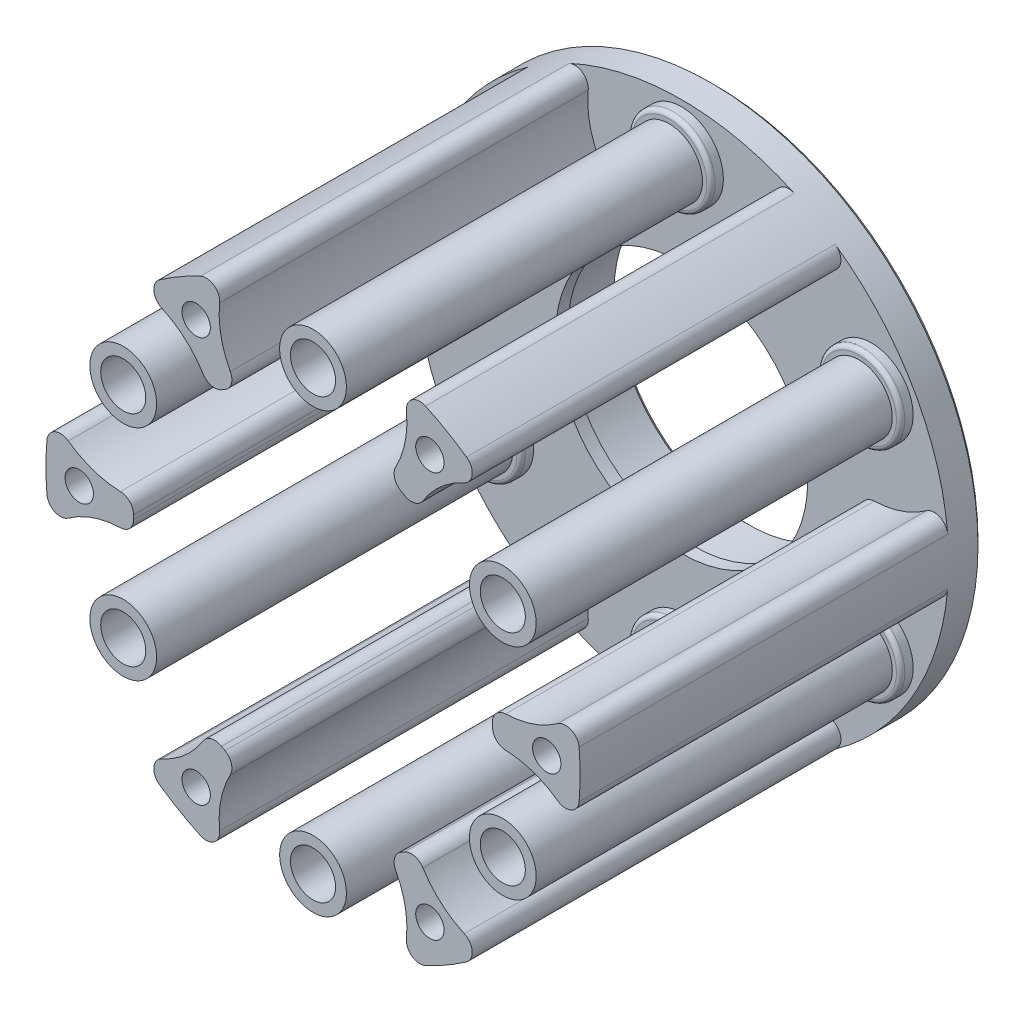
from build123d import *

# Parameters (mm, degrees)
SKETCH1_R               = 32
SKETCH1_R_2             = 2.7
SKETCH1_R_3             = 2.6999999999999793
SKETCH1_R_4             = 2.69999999999999
SKETCH1_R_5             = 2.700000000000006
SKETCH1_R_6             = 2.699999999999994
SKETCH1_R_7             = 2.700000000000001
BOSS_EXTRUDE1_DEPTH     = 4
SKETCH2_R               = 4.000000000000011
SKETCH2_R_2             = 2.7
BOSS_EXTRUDE2_DEPTH     = 44.16053674
SKETCH3_R               = 5.000000000000011
SKETCH3_R_2             = 4.000000000000011
BOSS_EXTRUDE3_DEPTH     = 1.5
BOSS_EXTRUDE4_DEPTH     = 44.16053674
FILLET2_R               = 0.5
FILLET5_R               = 1.61977879287575
CIRPATTERN1_START       = 4
CIRPATTERN1_DEPTH       = 44.16053674
CHAMFER1_SIZE           = 0.5
SKETCH9_R               = 8
CUT_EXTRUDE4_DEPTH      = 64.23094991218304
BOSS_EXTRUDE7_START     = -6.5
SKETCH10_R              = 8
SKETCH10_R_2            = 6.500000000000002
BOSS_EXTRUDE7_DEPTH     = 6.5
CUT_EXTRUDE5_DEPTH      = 64.23094991218304
CUT_EXTRUDE5_DEPTH_BACK = 64.23094991218304
SKETCH14_R              = 16.1
SKETCH15_R              = 16.1
SKETCH15_R_2            = 15.1
BOSS_EXTRUDE8_DEPTH     = 1.5
SKETCH16_R              = 18.099999999999998
SKETCH16_R_2            = 16.1
BOSS_EXTRUDE9_DEPTH     = 4.5
CHAMFER3_SIZE2          = 4.5
CHAMFER3_SIZE           = 2
SKETCH5_R               = 1.6999999999999995
CUT_EXTRUDE1_DEPTH      = 70.43437291820881
CUT_EXTRUDE3_START      = -5
SKETCH7_R               = 4.45
CUT_EXTRUDE3_DEPTH      = 72.08658957395971
CUT_EXTRUDE2_START      = -3
SKETCH6_R               = 2.949999999999979
CUT_EXTRUDE2_DEPTH      = 70.08658957395971
CIRPATTERN2_COUNT       = 6
CHAMFER4_SIZE           = 0.5


# Read off the part's stored shape, not the designer's step: CirPattern1
with BuildPart() as part:
    # Sketch1 → Boss-Extrude1 (new body)
    with BuildSketch(Plane.XY):
        Circle(SKETCH1_R)
        with Locations((-6.5e-16, 26.25)):
            Circle(SKETCH1_R_2, mode=Mode.SUBTRACT)
        with Locations((22.73316684934151, 13.125000000000004)):
            Circle(SKETCH1_R_3, mode=Mode.SUBTRACT)
        with Locations((22.733166849341515, -13.124999999999995)):
            Circle(SKETCH1_R_4, mode=Mode.SUBTRACT)
        with Locations((3.87e-15, -26.25)):
            Circle(SKETCH1_R_5, mode=Mode.SUBTRACT)
        with Locations((-22.733166849341508, -13.125000000000012)):
            Circle(SKETCH1_R_6, mode=Mode.SUBTRACT)
        with Locations((-22.733166849341515, 13.125000000000002)):
            Circle(SKETCH1_R_7, mode=Mode.SUBTRACT)
    extrude(amount=BOSS_EXTRUDE1_DEPTH)

    # Sketch2 → Boss-Extrude2 (add)
    with BuildSketch(Plane.XY.offset(4)):
        with Locations((-6.5e-16, 26.25)):
            Circle(SKETCH2_R)
        with Locations((-6.5e-16, 26.25)):
            Circle(SKETCH2_R_2, mode=Mode.SUBTRACT)
    extrude(amount=BOSS_EXTRUDE2_DEPTH)

    # Sketch3 → Boss-Extrude3 (add)
    with BuildSketch(Plane.XY.offset(4)):
        with Locations((-6.5e-16, 26.25)):
            Circle(SKETCH3_R)
        with Locations((-6.5e-16, 26.25)):
            Circle(SKETCH3_R_2, mode=Mode.SUBTRACT)
    extrude(amount=BOSS_EXTRUDE3_DEPTH)

    # Sketch4 → Boss-Extrude4 (add)
    with BuildSketch(Plane.XY.offset(4)):
        with BuildLine():
            ThreePointArc((-9.014254270063137, 19.51904761904762), (-11.13928536235289, 24.675572606923186), (-10.526593038477948, 30.219047619047622))
            ThreePointArc((-10.52659303847795, 30.21904761904762), (-16.000000000000043, 27.71281292110201), (-20.907166397027993, 24.22582079614607))
            ThreePointArc((-20.907166397027996, 24.225820796146074), (-15.800030049346507, 21.984690407263294), (-12.39686396074188, 17.566097003570803))
            ThreePointArc((-12.396863960741879, 17.566097003570803), (-10.750000000000021, 18.61954618136542), (-9.014254270063137, 19.51904761904762))
        make_face()
    extrude(amount=BOSS_EXTRUDE4_DEPTH)

    # Fillet2
    fillet2_edges = [part.edges().sort_by_distance(p)[0] for p in [
        (-5.0000000000000115, 26.25, 5.5),
    ]]
    fillet(fillet2_edges, radius=FILLET2_R)

    # Fillet5
    fillet5_edges = [part.edges().sort_by_distance(p)[0] for p in [
        (-10.52659303847795, 30.219047619047622, 26.08026837),
        (-20.907166397027993, 24.22582079614607, 26.08026837),
        (-12.396863960741879, 17.566097003570803, 26.08026837),
        (-9.014254270063137, 19.51904761904762, 26.08026837),
    ]]
    fillet(fillet5_edges, radius=FILLET5_R)

    # CirPattern1 outline → CirPattern1 (add)
    with BuildSketch(Plane.XY.offset(CIRPATTERN1_START)):
        with BuildLine():
            ThreePointArc((-21.498630106, 0.242700588), (-21.94958884, 1.382495109), (-23.069832464, 1.880038628))
            ThreePointArc((-23.069832464, 1.880038628), (-26.350618082, 2.472462904), (-29.31372479, 4.000376326))
            ThreePointArc((-29.31372479, 4.000376326), (-30.934551738, 4.15979527), (-31.874628466, 2.829851609))
            ThreePointArc((-31.874628466, 2.829851609), (-32, 0), (-31.874628466, -2.829851609))
            ThreePointArc((-31.874628466, -2.829851609), (-30.934551738, -4.15979527), (-29.31372479, -4.000376326))
            ThreePointArc((-29.31372479, -4.000376326), (-26.350618082, -2.472462904), (-23.069832464, -1.880038628))
            ThreePointArc((-23.069832464, -1.880038628), (-21.94958884, -1.382495109), (-21.498630106, -0.242700588))
            ThreePointArc((-21.498630106, -0.242700588), (-21.5, 0), (-21.498630106, 0.242700588))
        make_face()
        with BuildLine():
            ThreePointArc((18.388037615, 26.189312184), (16, 27.712812921), (13.486590851, 29.019163793))
            ThreePointArc((13.486590851, 29.019163793), (11.86478749, 28.870005296), (11.192434872, 27.386618511))
            ThreePointArc((11.192434872, 27.386618511), (11.034093356, 24.056536116), (9.90675502, 20.919080289))
            ThreePointArc((9.90675502, 20.919080289), (9.777518535, 19.700149093), (10.539130178, 18.739710112))
            ThreePointArc((10.539130178, 18.739710112), (10.75, 18.619546181), (10.959499928, 18.497009524))
            ThreePointArc((10.959499928, 18.497009524), (12.172070305, 18.317653984), (13.163077444, 19.039041661))
            ThreePointArc((13.163077444, 19.039041661), (15.316524725, 21.584073212), (18.121289918, 23.386242185))
            ThreePointArc((18.121289918, 23.386242185), (19.069764248, 24.710210026), (18.388037615, 26.189312184))
        make_face()
        with BuildLine():
            ThreePointArc((-18.121289918, -23.386242185), (-19.069764248, -24.710210026), (-18.388037615, -26.189312184))
            ThreePointArc((-18.388037615, -26.189312184), (-16, -27.712812921), (-13.486590851, -29.019163793))
            ThreePointArc((-13.486590851, -29.019163793), (-11.86478749, -28.870005296), (-11.192434872, -27.386618511))
            ThreePointArc((-11.192434872, -27.386618511), (-11.034093356, -24.056536116), (-9.90675502, -20.919080289))
            ThreePointArc((-9.90675502, -20.919080289), (-9.777518535, -19.700149093), (-10.539130178, -18.739710112))
            ThreePointArc((-10.539130178, -18.739710112), (-10.75, -18.619546181), (-10.959499928, -18.497009524))
            ThreePointArc((-10.959499928, -18.497009524), (-12.172070305, -18.317653984), (-13.163077444, -19.039041661))
            ThreePointArc((-13.163077444, -19.039041661), (-15.316524725, -21.584073212), (-18.121289918, -23.386242185))
        make_face()
        with BuildLine():
            ThreePointArc((31.874628466, -2.829851609), (32, 0), (31.874628466, 2.829851609))
            ThreePointArc((31.874628466, 2.829851609), (30.934551738, 4.15979527), (29.31372479, 4.000376326))
            ThreePointArc((29.31372479, 4.000376326), (26.350618082, 2.472462904), (23.069832464, 1.880038628))
            ThreePointArc((23.069832464, 1.880038628), (21.94958884, 1.382495109), (21.498630106, 0.242700588))
            ThreePointArc((21.498630106, 0.242700588), (21.5, 0), (21.498630106, -0.242700588))
            ThreePointArc((21.498630106, -0.242700588), (21.94958884, -1.382495109), (23.069832464, -1.880038628))
            ThreePointArc((23.069832464, -1.880038628), (26.350618082, -2.472462904), (29.31372479, -4.000376326))
            ThreePointArc((29.31372479, -4.000376326), (30.934551738, -4.15979527), (31.874628466, -2.829851609))
        make_face()
        with BuildLine():
            ThreePointArc((11.192434872, -27.386618511), (11.86478749, -28.870005296), (13.486590851, -29.019163793))
            ThreePointArc((13.486590851, -29.019163793), (16, -27.712812921), (18.388037615, -26.189312184))
            ThreePointArc((18.388037615, -26.189312184), (19.069764248, -24.710210026), (18.121289918, -23.386242185))
            ThreePointArc((18.121289918, -23.386242185), (15.316524725, -21.584073212), (13.163077444, -19.039041661))
            ThreePointArc((13.163077444, -19.039041661), (12.172070305, -18.317653984), (10.959499928, -18.497009524))
            ThreePointArc((10.959499928, -18.497009524), (10.75, -18.619546181), (10.539130178, -18.739710112))
            ThreePointArc((10.539130178, -18.739710112), (9.777518535, -19.700149093), (9.90675502, -20.919080289))
            ThreePointArc((9.90675502, -20.919080289), (11.034093356, -24.056536116), (11.192434872, -27.386618511))
        make_face()
    extrude(amount=CIRPATTERN1_DEPTH)

    # CirPattern1 2 outline → CirPattern1 2 (revolve)
    with BuildSketch(Plane(origin=(22.733166849, -13.125, 0), x_dir=(1, 0, 0), z_dir=(0, -1, 0))):
        with BuildLine():
            Line((4, 48.16053674), (2.7, 48.16053674))
            Line((2.7, 48.16053674), (2.7, 4))
            Line((2.7, 4), (5, 4))
            Line((5, 4), (5, 5))
            ThreePointArc((5, 5), (4.853553391, 5.353553391), (4.5, 5.5))
            Line((4.5, 5.5), (4, 5.5))
            Line((4, 5.5), (4, 48.16053674))
        make_face()
    revolve(axis=Axis((22.733166849, -13.125, 0), (0, 0, 1)))

    # CirPattern1 3 outline → CirPattern1 3 (revolve)
    with BuildSketch(Plane(origin=(22.733166849, 13.125, 0), x_dir=(1, 0, 0), z_dir=(0, -1, 0))):
        with BuildLine():
            Line((4, 48.16053674), (2.7, 48.16053674))
            Line((2.7, 48.16053674), (2.7, 4))
            Line((2.7, 4), (5, 4))
            Line((5, 4), (5, 5))
            ThreePointArc((5, 5), (4.853553391, 5.353553391), (4.5, 5.5))
            Line((4.5, 5.5), (4, 5.5))
            Line((4, 5.5), (4, 48.16053674))
        make_face()
    revolve(axis=Axis((22.733166849, 13.125, 0), (0, 0, 1)))

    # CirPattern1 4 outline → CirPattern1 4 (revolve)
    with BuildSketch(Plane.XZ.offset(26.25)):
        with BuildLine():
            Line((4, 48.16053674), (2.7, 48.16053674))
            Line((2.7, 48.16053674), (2.7, 4))
            Line((2.7, 4), (5, 4))
            Line((5, 4), (5, 5))
            ThreePointArc((5, 5), (4.853553391, 5.353553391), (4.5, 5.5))
            Line((4.5, 5.5), (4, 5.5))
            Line((4, 5.5), (4, 48.16053674))
        make_face()
    revolve(axis=Axis((0, -26.25, 0), (0, 0, 1)))

    # CirPattern1 5 outline → CirPattern1 5 (revolve)
    with BuildSketch(Plane(origin=(-22.733166849, -13.125, 0), x_dir=(1, 0, 0), z_dir=(0, -1, 0))):
        with BuildLine():
            Line((4, 48.16053674), (2.7, 48.16053674))
            Line((2.7, 48.16053674), (2.7, 4))
            Line((2.7, 4), (5, 4))
            Line((5, 4), (5, 5))
            ThreePointArc((5, 5), (4.853553391, 5.353553391), (4.5, 5.5))
            Line((4.5, 5.5), (4, 5.5))
            Line((4, 5.5), (4, 48.16053674))
        make_face()
    revolve(axis=Axis((-22.733166849, -13.125, 0), (0, 0, 1)))

    # CirPattern1 6 outline → CirPattern1 6 (revolve)
    with BuildSketch(Plane(origin=(-22.733166849, 13.125, 0), x_dir=(1, 0, 0), z_dir=(0, -1, 0))):
        with BuildLine():
            Line((4, 48.16053674), (2.7, 48.16053674))
            Line((2.7, 48.16053674), (2.7, 4))
            Line((2.7, 4), (5, 4))
            Line((5, 4), (5, 5))
            ThreePointArc((5, 5), (4.853553391, 5.353553391), (4.5, 5.5))
            Line((4.5, 5.5), (4, 5.5))
            Line((4, 5.5), (4, 48.16053674))
        make_face()
    revolve(axis=Axis((-22.733166849, 13.125, 0), (0, 0, 1)))

    # Chamfer1
    chamfer1_edges = [part.edges().sort_by_distance(p)[0] for p in [
        (-32, 3.92e-15, 0),
    ]]
    chamfer(chamfer1_edges, length=CHAMFER1_SIZE)

    # Sketch9 → Cut-Extrude4 (cut, through all)
    with BuildSketch(Plane.XY.offset(4)):
        Circle(SKETCH9_R)
    extrude(amount=-CUT_EXTRUDE4_DEPTH, mode=Mode.SUBTRACT)

    # Sketch10 → Boss-Extrude7 (add)
    with BuildSketch(Plane(origin=(0, 0, 0), x_dir=(-1, 0, 0), z_dir=(0, 0, -1)).offset(BOSS_EXTRUDE7_START)):
        Circle(SKETCH10_R)
        Circle(SKETCH10_R_2, mode=Mode.SUBTRACT)
    extrude(amount=BOSS_EXTRUDE7_DEPTH)

    # Sketch14 → Cut-Extrude5 (cut, two sides: drawn at the far end of the back side and taken through both)
    with BuildSketch(Plane.XY.offset(4).offset(-CUT_EXTRUDE5_DEPTH_BACK)):
        Circle(SKETCH14_R)
    extrude(amount=CUT_EXTRUDE5_DEPTH + CUT_EXTRUDE5_DEPTH_BACK, mode=Mode.SUBTRACT)

    # Sketch15 → Boss-Extrude8 (add)
    with BuildSketch(Plane.XY.offset(4)):
        Circle(SKETCH15_R)
        Circle(SKETCH15_R_2, mode=Mode.SUBTRACT)
    extrude(amount=-BOSS_EXTRUDE8_DEPTH)

    # Sketch16 → Boss-Extrude9 (add)
    with BuildSketch(Plane(origin=(0, 0, 0), x_dir=(-1, 0, 0), z_dir=(0, 0, -1))):
        with Locations(Location((0, 0, 0), (0, 0, 180))):
            Circle(SKETCH16_R)
        with Locations(Location((0, 0, 0), (0, 0, 180))):
            Circle(SKETCH16_R_2, mode=Mode.SUBTRACT)
    extrude(amount=BOSS_EXTRUDE9_DEPTH)

    # Chamfer3
    chamfer3_edges = [part.edges().sort_by_distance(p)[0] for p in [
        (-18.099999999999998, -4.43e-15, 0),
    ]]
    chamfer3_side = [part.faces().sort_by_distance(p)[0] for p in [
        (-18.139999999999997, -4.44e-15, 0),
    ]]
    chamfer(chamfer3_edges, length=CHAMFER3_SIZE - 0.0001, length2=CHAMFER3_SIZE2 - 0.0001, reference=chamfer3_side[0])  # a hair under: the kernel refuses the full size

    # Sketch5 → Cut-Extrude1 (cut, through all)
    with BuildSketch(Plane.XY.offset(48.16053674)):
        with Locations((-14.000000000000037, 24.248711305964267)):
            Circle(SKETCH5_R)
    cut_extrude1 = extrude(amount=-CUT_EXTRUDE1_DEPTH, mode=Mode.SUBTRACT)

    # Sketch7 → Cut-Extrude3 (cut)
    with BuildSketch(Plane(origin=(0, 0, 0), x_dir=(-1, 0, 0), z_dir=(0, 0, -1)).offset(CUT_EXTRUDE3_START)):
        with Locations(Location((6.5e-16, 26.25, 0), (0, 0, 180))):
            Circle(SKETCH7_R)
    cut_extrude3 = extrude(amount=CUT_EXTRUDE3_DEPTH, mode=Mode.SUBTRACT)

    # Sketch6 → Cut-Extrude2 (cut)
    with BuildSketch(Plane(origin=(0, 0, 0), x_dir=(-1, 0, 0), z_dir=(0, 0, -1)).offset(CUT_EXTRUDE2_START)):
        with Locations(Location((14.000000000000037, 24.248711305964267, 0), (0, 0, 180))):
            Circle(SKETCH6_R)
    cut_extrude2 = extrude(amount=CUT_EXTRUDE2_DEPTH, mode=Mode.SUBTRACT)

    # CirPattern2: Cut-Extrude1, Cut-Extrude3, Cut-Extrude2 ×6 about axis
    cirpattern2_axis = Axis((-2.969e-14, -1.173e-14, 0), (0, 0, 1))
    add([cut_extrude1.rotate(cirpattern2_axis, i * 360 / CIRPATTERN2_COUNT) for i in range(1, CIRPATTERN2_COUNT)], mode=Mode.SUBTRACT)
    add([cut_extrude3.rotate(cirpattern2_axis, i * 360 / CIRPATTERN2_COUNT) for i in range(1, CIRPATTERN2_COUNT)], mode=Mode.SUBTRACT)
    add([cut_extrude2.rotate(cirpattern2_axis, i * 360 / CIRPATTERN2_COUNT) for i in range(1, CIRPATTERN2_COUNT)], mode=Mode.SUBTRACT)

    # Chamfer4
    chamfer4_edges = [part.edges().sort_by_distance(p)[0] for p in [
        (-16.1, -3.94e-15, -4.5),
    ]]
    chamfer(chamfer4_edges, length=CHAMFER4_SIZE)


solid = part.part
